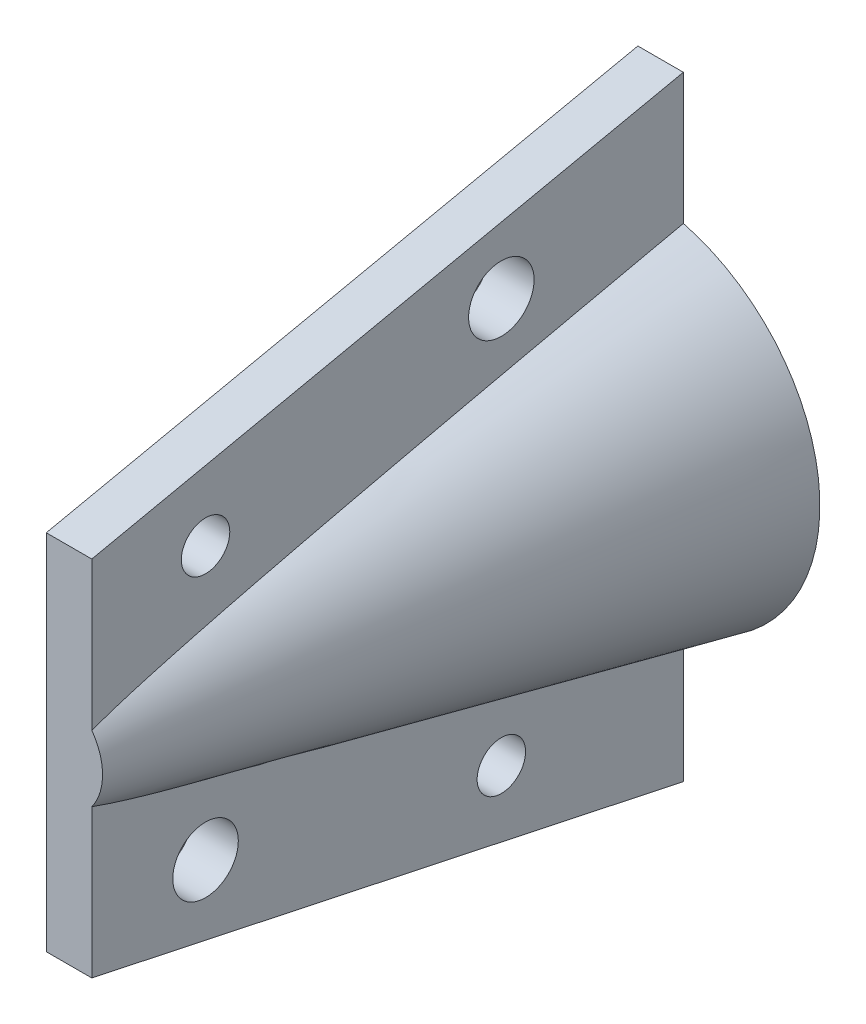
from build123d import *

# Parameters (mm, degrees)
SKETCH1_R                   = 8.89
BOSS_EXTRUDE1_DEPTH         = 30.48
BOSS_EXTRUDE1_TAPER         = 14
DOME1_FACE_RADIUS           = 1.290482473
DOME1_HEIGHT                = 0.635
BOSS_EXTRUDE2_DEPTH         = 33.02
DRAFT1_ANGLE                = -12
F_27_0_144_DIAMETER_HOLE1_D = 3.6576
F_6_32_TAPPED_HOLE1_D       = 2.7051
F_6_32_TAPPED_HOLE1_DEPTH   = 11.176
F_6_32_TAPPED_HOLE1_TIP     = 0.81269403
SKETCH12_W                  = 10.592126778
SKETCH12_H                  = 34.29
CUT_EXTRUDE1_DEPTH          = 39.568082983


with BuildPart() as part:
    # Sketch1 → Boss-Extrude1 (new body)
    with BuildSketch(Plane.XY):
        Circle(SKETCH1_R)
    extrude(amount=BOSS_EXTRUDE1_DEPTH, taper=BOSS_EXTRUDE1_TAPER)

    # Dome1: a dome of height H over a round flat face of radius A is a cap of a sphere of radius (A * A + H * H) / (2 * H)
    dome1_r = (DOME1_FACE_RADIUS * DOME1_FACE_RADIUS + DOME1_HEIGHT * DOME1_HEIGHT) / (2 * DOME1_HEIGHT)
    dome1_base = Plane((0, 0, 30.48), z_dir=(0, 0, 1))
    with Locations(dome1_base.offset(DOME1_HEIGHT - dome1_r)):
        dome1_ball = Sphere(dome1_r, mode=Mode.PRIVATE)
    add(split(dome1_ball, bisect_by=dome1_base, keep=Keep.TOP, mode=Mode.PRIVATE))


with BuildPart() as body_2:
    # Sketch2 → Boss-Extrude2 (new body)
    with BuildSketch(Plane.XY):
        with BuildLine():
            Line((-2.54, 17.145), (-2.54, 9.837377699))
            ThreePointArc((-2.54, 9.837377699), (-10.16, 0), (-2.54, -9.837377699))
            Line((-2.54, -9.837377699), (-2.54, -17.145))
            Line((-2.54, -17.145), (2.54, -17.145))
            Line((2.54, -17.145), (2.54, -9.837377699))
            ThreePointArc((2.54, -9.837377699), (10.16, 0), (2.54, 9.837377699))
            Line((2.54, 9.837377699), (2.54, 17.145))
            Line((2.54, 17.145), (-2.54, 17.145))
        make_face()
    extrude(amount=BOSS_EXTRUDE2_DEPTH)

    # Combine1: read off the stored shape, not the designer's step
    # Combine1: cut part
    add(part.part, mode=Mode.SUBTRACT)

    # Draft1
    draft1_faces = [body_2.faces().sort_by_distance(p)[0] for p in [
        (0, -17.145, 16.51),
        (0, 17.145, 16.51),
        (10.16, 0, 16.51),
        (-10.16, 0, 16.51),
    ]]
    draft(draft1_faces, Plane(origin=(0, 0, 0), x_dir=(-1, 0, 0), z_dir=(0, 0, -1)), DRAFT1_ANGLE)

    # #27 (0.144) Diameter Hole1 (through all)
    with Locations(Plane.ZY.offset(2.54)):
        with Locations((10.16, 11.285999498), (26.67, -7.590126179)):
            Hole(F_27_0_144_DIAMETER_HOLE1_D / 2)

    # #6-32 Tapped Hole1
    with Locations(Plane.ZY.offset(2.54)):
        with Locations((26.67, 7.590126179), (10.16, -11.285999498)):
            Hole(F_6_32_TAPPED_HOLE1_D / 2, depth=F_6_32_TAPPED_HOLE1_DEPTH)
            with Locations((0, 0, -(F_6_32_TAPPED_HOLE1_DEPTH + F_6_32_TAPPED_HOLE1_TIP / 2))):  # 118° drill point
                Cone(0, F_6_32_TAPPED_HOLE1_D / 2, F_6_32_TAPPED_HOLE1_TIP, mode=Mode.SUBTRACT)

    # Sketch12 → Cut-Extrude1 (cut, through all)
    with BuildSketch(Plane(origin=(0, 0, 0), x_dir=(-1, 0, 0), z_dir=(0, 0, -1))):
        with Locations((5.296063389, 0)):
            Rectangle(SKETCH12_W, SKETCH12_H)
    extrude(amount=-CUT_EXTRUDE1_DEPTH, mode=Mode.SUBTRACT)


solid = body_2.part
